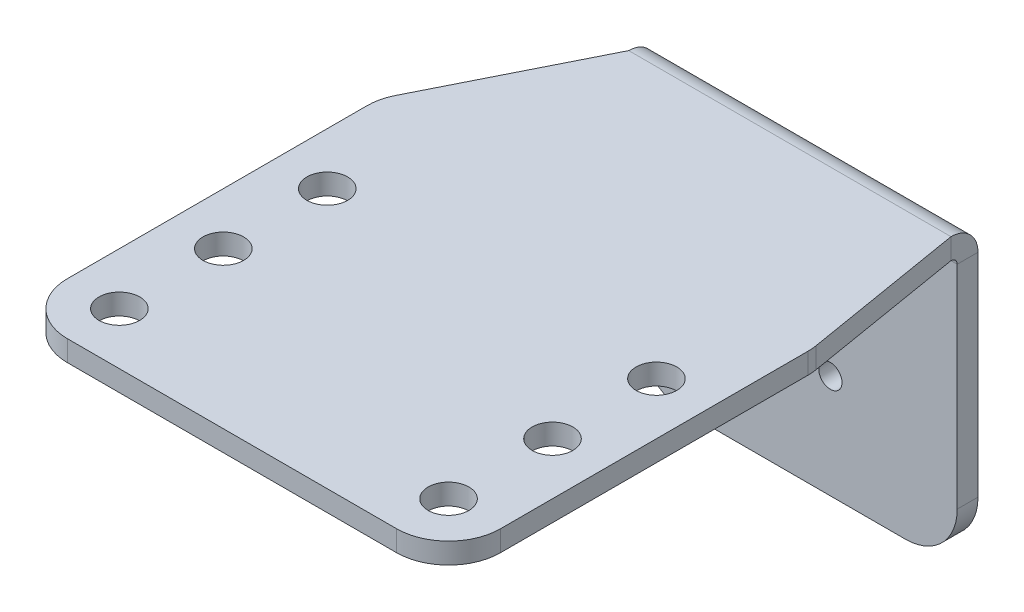
from build123d import *

# Parameters (mm, degrees)
SKETCH1_R           = 2.4892
SKETCH1_R_2         = 1.4224
BOSS_EXTRUDE1_DEPTH = 3.175
BASE_FLANGE1_DEPTH  = 2.54
EDGE_FLANGE1_START  = 10.16
EDGE_FLANGE1_DEPTH  = 39.37
SKETCH10_R          = 2.4892
CUT_EXTRUDE1_DEPTH  = 115.617842028
SKETCH11_R          = 1.4224
CUT_EXTRUDE2_DEPTH  = 93.32708809
FILLET1_R           = 6.35


# Read off the part's stored shape, not the designer's step: Edge-Flange1
# Sheet-metal steps are written as plain solids
with BuildPart() as part:
    # Sketch1 → Boss-Extrude1 (new body)
    with BuildSketch(Plane(origin=(0, 0, 0), x_dir=(1, 0, 0), z_dir=(0, 1, 0))):
        Polygon((0, 0), (52.916666667, 0), (52.916666667, 44.45), (44.45, 95.25), (25.4, 95.25), (0, 44.45), align=None)
        with Locations(Location((6.35, 6.35, 0), (0, 0, 270))):
            Circle(SKETCH1_R, mode=Mode.SUBTRACT)
        with Locations(Location((6.35, 19.05, 0), (0, 0, 270))):
            Circle(SKETCH1_R, mode=Mode.SUBTRACT)
        with Locations(Location((6.35, 31.75, 0), (0, 0, 270))):
            Circle(SKETCH1_R, mode=Mode.SUBTRACT)
        with Locations(Location((46.566666667, 6.35, 0), (0, 0, 270))):
            Circle(SKETCH1_R, mode=Mode.SUBTRACT)
        with Locations(Location((46.566666667, 19.05, 0), (0, 0, 270))):
            Circle(SKETCH1_R, mode=Mode.SUBTRACT)
        with Locations(Location((46.566666667, 31.75, 0), (0, 0, 270))):
            Circle(SKETCH1_R, mode=Mode.SUBTRACT)
        with Locations(Location((31.75508, 82.56016, 0), (0, 0, 270))):
            Circle(SKETCH1_R_2, mode=Mode.SUBTRACT)
        with Locations(Location((39.755080002, 82.56016, 0), (0, 0, 270))):
            Circle(SKETCH1_R_2, mode=Mode.SUBTRACT)
    extrude(amount=BOSS_EXTRUDE1_DEPTH)


with BuildPart() as body_2:
    # Sketch2 → Base-Flange1 (new body)
    with BuildSketch(Plane(origin=(0, 0, 0), x_dir=(1, 0, 0), z_dir=(0, 1, 0))):
        Polygon((0, 0), (52.916666667, 0), (52.916666667, 44.45), (49.53, 64.77), (10.16, 64.77), (0, 44.45), align=None)
    extrude(amount=BASE_FLANGE1_DEPTH)

    # Edge-Flange1 outline → Edge-Flange1 (add)
    with BuildSketch(Plane.YZ.offset(EDGE_FLANGE1_START)):
        with BuildLine():
            Line((-33.02, -68.072), (-0.762, -68.072))
            ThreePointArc((-0.762, -68.072), (1.572866591, -67.104866591), (2.54, -64.77))
            Line((2.54, -64.77), (0, -64.77))
            ThreePointArc((0, -64.77), (-0.223184633, -65.308815367), (-0.762, -65.532))
            Line((-0.762, -65.532), (-33.02, -65.532))
            Line((-33.02, -65.532), (-33.02, -68.072))
        make_face()
    extrude(amount=EDGE_FLANGE1_DEPTH)

    # Sketch10 → Cut-Extrude1 (cut, through all)
    with BuildSketch(Plane(origin=(0, 2.54, 0), x_dir=(1, 0, 0), z_dir=(0, 1, 0))):
        with Locations(Location((46.566666667, 31.75, 0), (0, 0, 270))):
            Circle(SKETCH10_R)
        with Locations(Location((46.566666667, 19.05, 0), (0, 0, 270))):
            Circle(SKETCH10_R)
        with Locations(Location((46.566666667, 6.35, 0), (0, 0, 270))):
            Circle(SKETCH10_R)
        with Locations(Location((6.35, 6.35, 0), (0, 0, 270))):
            Circle(SKETCH10_R)
        with Locations(Location((6.35, 19.05, 0), (0, 0, 270))):
            Circle(SKETCH10_R)
        with Locations(Location((6.35, 31.75, 0), (0, 0, 270))):
            Circle(SKETCH10_R)
    extrude(amount=-CUT_EXTRUDE1_DEPTH, mode=Mode.SUBTRACT)

    # Sketch11 → Cut-Extrude2 (cut, through all)
    with BuildSketch(Plane(origin=(0, 0, -68.072), x_dir=(-1, 0, 0), z_dir=(0, 0, -1))):
        with Locations(Location((-34.035000002, -20.32, 0), (0, 0, 90))):
            Circle(SKETCH11_R)
        with Locations(Location((-26.035, -20.32, 0), (0, 0, 90))):
            Circle(SKETCH11_R)
    extrude(amount=-CUT_EXTRUDE2_DEPTH, mode=Mode.SUBTRACT)

    # Fillet1
    fillet1_edges = [body_2.edges().sort_by_distance(p)[0] for p in [
        (0, 1.27, -44.45),
        (52.916666667, 1.27, -44.45),
        (52.916666667, 1.27, 0),
        (0, 1.27, 0),
        (10.16, -33.02, -66.802),
        (49.53, -33.02, -66.802),
    ]]
    fillet(fillet1_edges, radius=FILLET1_R)


solid = body_2.part
